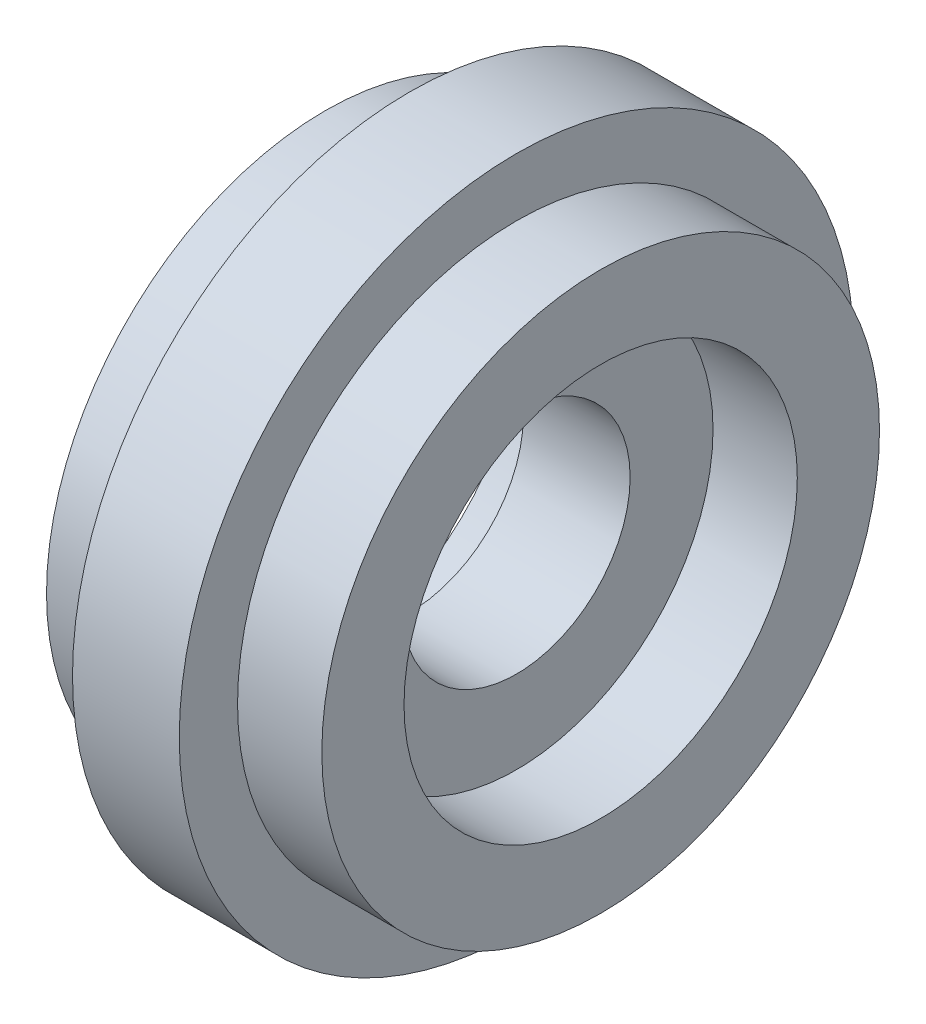
from build123d import *

# Parameters (mm, degrees)
F_8_1_8_1_DURCHMESSER_BOHRUNG1_D = 8.1


with BuildPart() as part:
    # Skizze1 → Rotation1 (revolve)
    with BuildSketch(Plane.XY):
        Polygon((0, 0), (0, 12), (1.9, 12), (1.9, 9.925), (4.9, 9.925), (4.9, 7), (1.9, 7), (1.9, 0), align=None)
    rotation1 = revolve(axis=Axis((0, 0, 0), (-1, 0, 0)))

    # Ø8.1 (8.1) Durchmesser Bohrung1 (through all)
    with Locations(Plane.ZY):
        with Locations((0, 0)):
            f_8_1_8_1_durchmesser_bohrung1 = Hole(F_8_1_8_1_DURCHMESSER_BOHRUNG1_D / 2)

    # Spiegeln1: Rotation1, Ø8.1 (8.1) Durchmesser Bohrung1 across plane
    add(rotation1.mirror(Plane(origin=(0, 0, 0), x_dir=(0, 0, 1), z_dir=(1, 0, 0))))
    add(f_8_1_8_1_durchmesser_bohrung1.mirror(Plane(origin=(0, 0, 0), x_dir=(0, 0, 1), z_dir=(1, 0, 0))), mode=Mode.SUBTRACT)


solid = part.part
